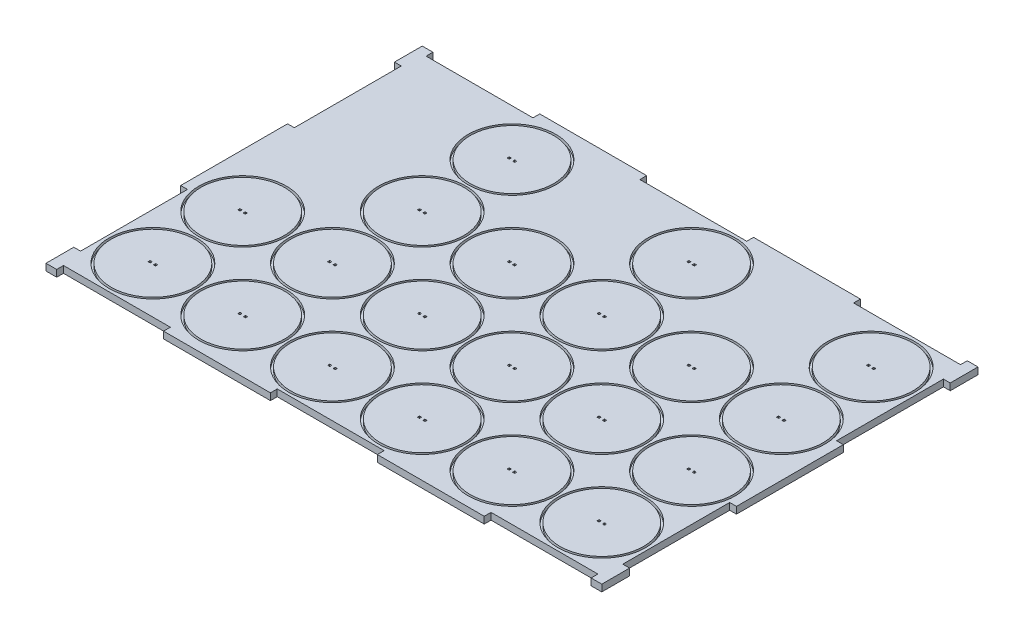
from build123d import *

# Parameters (mm, degrees)
SKETCH3_W                = 260
SKETCH3_H                = 176
BOSS_EXTRUDE2_DEPTH      = 1.5875
SKETCH4_R                = 20.5
SKETCH4_R_2              = 19.5
CUT_EXTRUDE1_DEPTH       = 1.5
SKETCH5_W                = 1
SKETCH5_H                = 1
CUT_EXTRUDE9_DEPTH       = 11.5
LPATTERN1_COUNT          = 4
LPATTERN1_PITCH          = 42
LPATTERN1_COUNT_DIR2     = 6
LPATTERN1_PITCH_DIR2     = 42
CUT_EXTRUDE10_DEPTH      = 158.016179501
CUT_EXTRUDE10_DEPTH_BACK = 11.5
SKETCH9_W                = 3.175
SKETCH9_H                = 50
SKETCH9_W_2              = 50
SKETCH9_H_2              = 3.18


with BuildPart() as part:
    # Sketch3 → Boss-Extrude2 (new, symmetric)
    with BuildSketch(Plane(origin=(0, 0, 0), x_dir=(1, 0, 0), z_dir=(0, 1, 0))):
        Rectangle(SKETCH3_W, SKETCH3_H)
    extrude(amount=BOSS_EXTRUDE2_DEPTH, both=True)

    # Sketch4 → Cut-Extrude1 (cut)
    # profile 1 of 20: a face of its own
    with BuildSketch(Plane(origin=(0, 1.5875, 0), x_dir=(1, 0, 0), z_dir=(0, 1, 0))):
        with Locations((63, -63)):
            Circle(SKETCH4_R)
        with Locations((63, -63)):
            Circle(SKETCH4_R_2, mode=Mode.SUBTRACT)
    # profile 2 of 20: a face of its own
    with BuildSketch(Plane(origin=(0, 1.5875, 0), x_dir=(1, 0, 0), z_dir=(0, 1, 0))):
        with Locations((105, -63)):
            Circle(SKETCH4_R)
        with Locations((105, -63)):
            Circle(SKETCH4_R_2, mode=Mode.SUBTRACT)
    # profile 3 of 20: a face of its own
    with BuildSketch(Plane(origin=(0, 1.5875, 0), x_dir=(1, 0, 0), z_dir=(0, 1, 0))):
        with Locations((21, -63)):
            Circle(SKETCH4_R)
        with Locations((21, -63)):
            Circle(SKETCH4_R_2, mode=Mode.SUBTRACT)
    # profile 4 of 20: a face of its own
    with BuildSketch(Plane(origin=(0, 1.5875, 0), x_dir=(1, 0, 0), z_dir=(0, 1, 0))):
        with Locations((-21, -63)):
            Circle(SKETCH4_R)
        with Locations((-21, -63)):
            Circle(SKETCH4_R_2, mode=Mode.SUBTRACT)
    # profile 5 of 20: a face of its own
    with BuildSketch(Plane(origin=(0, 1.5875, 0), x_dir=(1, 0, 0), z_dir=(0, 1, 0))):
        with Locations((-63, -63)):
            Circle(SKETCH4_R)
        with Locations((-63, -63)):
            Circle(SKETCH4_R_2, mode=Mode.SUBTRACT)
    # profile 6 of 20: a face of its own
    with BuildSketch(Plane(origin=(0, 1.5875, 0), x_dir=(1, 0, 0), z_dir=(0, 1, 0))):
        with Locations((-105, -63)):
            Circle(SKETCH4_R)
        with Locations((-105, -63)):
            Circle(SKETCH4_R_2, mode=Mode.SUBTRACT)
    # profile 7 of 20: a face of its own
    with BuildSketch(Plane(origin=(0, 1.5875, 0), x_dir=(1, 0, 0), z_dir=(0, 1, 0))):
        with Locations((63, -21)):
            Circle(SKETCH4_R)
        with Locations((63, -21)):
            Circle(SKETCH4_R_2, mode=Mode.SUBTRACT)
    # profile 8 of 20: a face of its own
    with BuildSketch(Plane(origin=(0, 1.5875, 0), x_dir=(1, 0, 0), z_dir=(0, 1, 0))):
        with Locations((21, -21)):
            Circle(SKETCH4_R)
        with Locations((21, -21)):
            Circle(SKETCH4_R_2, mode=Mode.SUBTRACT)
    # profile 9 of 20: a face of its own
    with BuildSketch(Plane(origin=(0, 1.5875, 0), x_dir=(1, 0, 0), z_dir=(0, 1, 0))):
        with Locations((-21, -21)):
            Circle(SKETCH4_R)
        with Locations((-21, -21)):
            Circle(SKETCH4_R_2, mode=Mode.SUBTRACT)
    # profile 10 of 20: a face of its own
    with BuildSketch(Plane(origin=(0, 1.5875, 0), x_dir=(1, 0, 0), z_dir=(0, 1, 0))):
        with Locations((-63, -21)):
            Circle(SKETCH4_R)
        with Locations((-63, -21)):
            Circle(SKETCH4_R_2, mode=Mode.SUBTRACT)
    # profile 11 of 20: a face of its own
    with BuildSketch(Plane(origin=(0, 1.5875, 0), x_dir=(1, 0, 0), z_dir=(0, 1, 0))):
        with Locations((-105, -21)):
            Circle(SKETCH4_R)
        with Locations((-105, -21)):
            Circle(SKETCH4_R_2, mode=Mode.SUBTRACT)
    # profile 12 of 20: a face of its own
    with BuildSketch(Plane(origin=(0, 1.5875, 0), x_dir=(1, 0, 0), z_dir=(0, 1, 0))):
        with Locations((63, 21)):
            Circle(SKETCH4_R)
        with Locations((63, 21)):
            Circle(SKETCH4_R_2, mode=Mode.SUBTRACT)
    # profile 13 of 20: a face of its own
    with BuildSketch(Plane(origin=(0, 1.5875, 0), x_dir=(1, 0, 0), z_dir=(0, 1, 0))):
        with Locations((21, 21)):
            Circle(SKETCH4_R)
        with Locations((21, 21)):
            Circle(SKETCH4_R_2, mode=Mode.SUBTRACT)
    # profile 14 of 20: a face of its own
    with BuildSketch(Plane(origin=(0, 1.5875, 0), x_dir=(1, 0, 0), z_dir=(0, 1, 0))):
        with Locations((-21, 21)):
            Circle(SKETCH4_R)
        with Locations((-21, 21)):
            Circle(SKETCH4_R_2, mode=Mode.SUBTRACT)
    # profile 15 of 20: a face of its own
    with BuildSketch(Plane(origin=(0, 1.5875, 0), x_dir=(1, 0, 0), z_dir=(0, 1, 0))):
        with Locations((-63, 21)):
            Circle(SKETCH4_R)
        with Locations((-63, 21)):
            Circle(SKETCH4_R_2, mode=Mode.SUBTRACT)
    # profile 16 of 20: a face of its own
    with BuildSketch(Plane(origin=(0, 1.5875, 0), x_dir=(1, 0, 0), z_dir=(0, 1, 0))):
        with Locations((21, 63)):
            Circle(SKETCH4_R)
        with Locations((21, 63)):
            Circle(SKETCH4_R_2, mode=Mode.SUBTRACT)
    # profile 17 of 20: a face of its own
    with BuildSketch(Plane(origin=(0, 1.5875, 0), x_dir=(1, 0, 0), z_dir=(0, 1, 0))):
        with Locations((-63, 63)):
            Circle(SKETCH4_R)
        with Locations((-63, 63)):
            Circle(SKETCH4_R_2, mode=Mode.SUBTRACT)
    # profile 18 of 20: a face of its own
    with BuildSketch(Plane(origin=(0, 1.5875, 0), x_dir=(1, 0, 0), z_dir=(0, 1, 0))):
        with Locations((105, -21)):
            Circle(SKETCH4_R)
        with Locations((105, -21)):
            Circle(SKETCH4_R_2, mode=Mode.SUBTRACT)
    # profile 19 of 20: a face of its own
    with BuildSketch(Plane(origin=(0, 1.5875, 0), x_dir=(1, 0, 0), z_dir=(0, 1, 0))):
        with Locations((105, 21)):
            Circle(SKETCH4_R)
        with Locations((105, 21)):
            Circle(SKETCH4_R_2, mode=Mode.SUBTRACT)
    # profile 20 of 20: a face of its own
    with BuildSketch(Plane(origin=(0, 1.5875, 0), x_dir=(1, 0, 0), z_dir=(0, 1, 0))):
        with Locations((105, 63)):
            Circle(SKETCH4_R)
        with Locations((105, 63)):
            Circle(SKETCH4_R_2, mode=Mode.SUBTRACT)
    extrude(amount=-CUT_EXTRUDE1_DEPTH, mode=Mode.SUBTRACT)

    # Sketch5 → Cut-Extrude9 (cut, symmetric)
    with BuildSketch(Plane(origin=(0, 1.5875, 0), x_dir=(1, 0, 0), z_dir=(0, 1, 0))):
        with Locations((103.73, -63)):
            Rectangle(SKETCH5_W, SKETCH5_H)
        with Locations((106.27, -63)):
            Rectangle(SKETCH5_W, SKETCH5_H)
    cut_extrude9 = extrude(amount=CUT_EXTRUDE9_DEPTH, both=True, mode=Mode.SUBTRACT)

    # LPattern1: Cut-Extrude9 4 × 6, 4 skipped
    with Locations(*[(-j * LPATTERN1_PITCH_DIR2, 0, -i * LPATTERN1_PITCH) for i in range(LPATTERN1_COUNT) for j in range(LPATTERN1_COUNT_DIR2) if (i, j) not in ((0, 0), (2, 5), (3, 1), (3, 3), (3, 5))]):
        add(cut_extrude9, mode=Mode.SUBTRACT)

    # Sketch9 → Cut-Extrude10 (cut, two sides: drawn at the far end of the back side and taken through both)
    with BuildSketch(Plane(origin=(0, 1.5875, 0), x_dir=(1, 0, 0), z_dir=(0, 1, 0)).offset(-CUT_EXTRUDE10_DEPTH_BACK)):
        with Locations((-128.4125, 50)):
            Rectangle(SKETCH9_W, SKETCH9_H)
        with Locations((-100, 86.41)):
            Rectangle(SKETCH9_W_2, SKETCH9_H_2)
        with Locations((-128.4125, -50)):
            Rectangle(SKETCH9_W, SKETCH9_H)
        with Locations((0, 86.41)):
            Rectangle(SKETCH9_W_2, SKETCH9_H_2)
        with Locations((-100, -86.41)):
            Rectangle(SKETCH9_W_2, SKETCH9_H_2)
        with Locations((100, 86.41)):
            Rectangle(SKETCH9_W_2, SKETCH9_H_2)
        with Locations((0, -86.41)):
            Rectangle(SKETCH9_W_2, SKETCH9_H_2)
        with Locations((128.4125, 50)):
            Rectangle(SKETCH9_W, SKETCH9_H)
        with Locations((100, -86.41)):
            Rectangle(SKETCH9_W_2, SKETCH9_H_2)
        with Locations((128.4125, -50)):
            Rectangle(SKETCH9_W, SKETCH9_H)
    extrude(amount=CUT_EXTRUDE10_DEPTH + CUT_EXTRUDE10_DEPTH_BACK, mode=Mode.SUBTRACT)


solid = part.part
